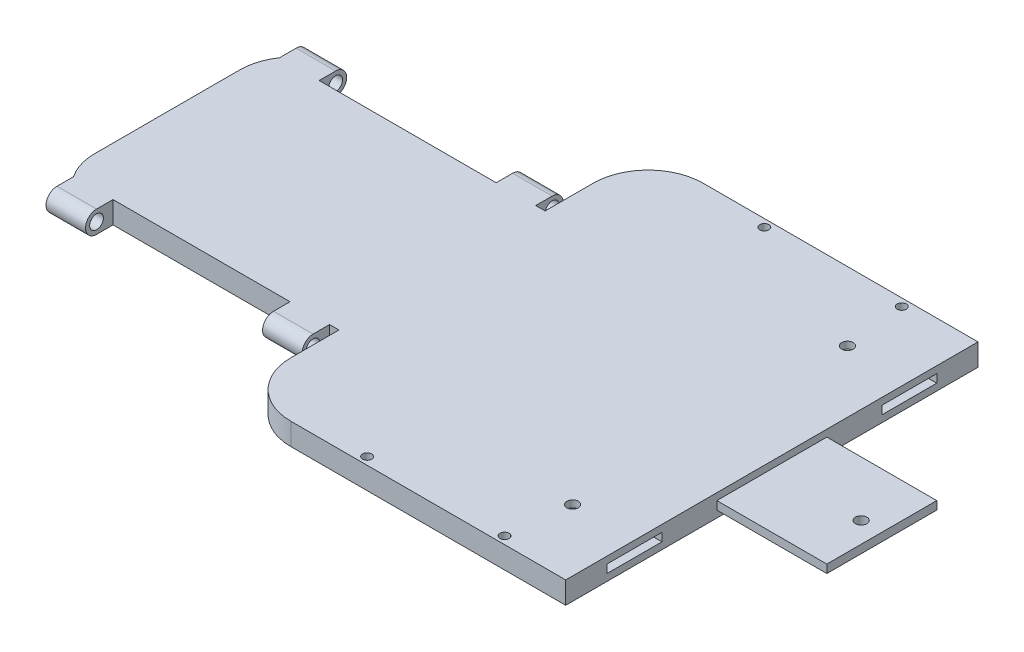
from build123d import *

# Parameters (mm, degrees)
BOSS_EXTRUDE1_DEPTH      = 8
BOSS_EXTRUDE2_DEPTH      = 46.583974855
BOSS_EXTRUDE2_DEPTH_BACK = 46.58397486
SKETCH4_R                = 3.3
CUT_EXTRUDE1_DEPTH       = 32.2
CUT_EXTRUDE1_DEPTH_BACK  = 32.2
SKETCH5_R                = 3.3
SKETCH6_W                = 40
SKETCH6_H                = 3
BOSS_EXTRUDE3_DEPTH      = 40
SKETCH7_R                = 2
CUT_EXTRUDE2_DEPTH       = 233.497849452
SKETCH8_W                = 20
SKETCH8_H                = 3
CUT_EXTRUDE3_DEPTH       = 30
SKETCH9_R                = 2
CUT_EXTRUDE4_DEPTH       = 233.570419443
FILLET1_R                = 20
SKETCH10_R               = 1.5
CUT_EXTRUDE5_DEPTH       = 10
SCALE1_SCALE             = 1.5
SCALE2_SCALE             = 0.8
SKETCH12_R               = 1.8
BOSS_EXTRUDE4_DEPTH      = 9.6
SKETCH13_R               = 2
SKETCH13_R_2             = 2.5
CUT_EXTRUDE6_DEPTH       = 262.790915701
BOSS_EXTRUDE5_REACH      = 322.905
SKETCH14_R               = 4.250728377
SKETCH14_R_2             = 3
SKETCH15_W               = 77.28
SKETCH15_H               = 12
CUT_EXTRUDE7_DEPTH       = 262.790915701
BOSS_EXTRUDE6_START      = -3.6
SKETCH16_R               = 2.5
BOSS_EXTRUDE6_DEPTH      = 3.6
SKETCH17_R               = 2.5
CUT_EXTRUDE8_DEPTH       = 262.698077073


with BuildPart() as part:
    # Sketch1 → Boss-Extrude1 (new body)
    with BuildSketch(Plane(origin=(0, 0, 0), x_dir=(1, 0, 0), z_dir=(0, 1, 0))):
        Polygon((-120, -37.5), (-120, -75), (0, -75), (0, 75), (-120, 75), (-120, 37.5), (-220, 37.5), (-220, -37.5), align=None)
    extrude(amount=BOSS_EXTRUDE1_DEPTH)

    # Sketch4 → Boss-Extrude2 (add, two sides: drawn at the far end of the back side and taken through both)
    # profile 1 of 2: a face of its own
    with BuildSketch(Plane.ZY.offset(170).offset(-BOSS_EXTRUDE2_DEPTH_BACK)):
        with BuildLine():
            Line((37.5, 8), (43.5, 8))
            ThreePointArc((43.5, 8), (47.5, 4), (43.5, 0))
            Line((43.5, 0), (37.5, 0))
            Line((37.5, 0), (37.5, 8))
        make_face()
        with Locations((43.5, 4)):
            Circle(SKETCH4_R, mode=Mode.SUBTRACT)
    # profile 2 of 2: a face of its own
    with BuildSketch(Plane.ZY.offset(170).offset(-BOSS_EXTRUDE2_DEPTH_BACK)):
        with BuildLine():
            Line((-37.5, 0), (-43.5, 0))
            ThreePointArc((-43.5, 0), (-47.5, 4), (-43.5, 8))
            Line((-43.5, 8), (-37.5, 8))
            Line((-37.5, 8), (-37.5, 0))
        make_face()
        with Locations((-43.5, 4)):
            Circle(SKETCH4_R, mode=Mode.SUBTRACT)
    extrude(amount=BOSS_EXTRUDE2_DEPTH + BOSS_EXTRUDE2_DEPTH_BACK)

    # Sketch5 → Cut-Extrude1 (cut, two sides: drawn at the far end of the back side and taken through both)
    # profile 1 of 2: a face of its own
    with BuildSketch(Plane.ZY.offset(170).offset(-CUT_EXTRUDE1_DEPTH_BACK)):
        with BuildLine():
            Line((-43.5, 8), (-37.5, 8))
            Line((-37.5, 8), (-37.5, 0))
            Line((-37.5, 0), (-43.5, 0))
            ThreePointArc((-43.5, 0), (-47.5, 4), (-43.5, 8))
        make_face()
        with Locations((-43.5, 4)):
            Circle(SKETCH5_R, mode=Mode.SUBTRACT)
    # profile 2 of 2: a face of its own
    with BuildSketch(Plane.ZY.offset(170).offset(-CUT_EXTRUDE1_DEPTH_BACK)):
        with BuildLine():
            Line((37.5, 0), (43.5, 0))
            ThreePointArc((43.5, 0), (47.5, 4), (43.5, 8))
            Line((43.5, 8), (37.5, 8))
            Line((37.5, 8), (37.5, 0))
        make_face()
        with Locations((43.5, 4)):
            Circle(SKETCH5_R, mode=Mode.SUBTRACT)
    extrude(amount=CUT_EXTRUDE1_DEPTH + CUT_EXTRUDE1_DEPTH_BACK, mode=Mode.SUBTRACT)

    # Sketch6 → Boss-Extrude3 (add)
    with BuildSketch(Plane(origin=(0, 0, 0), x_dir=(0, 0, -1), z_dir=(1, 0, 0))):
        with Locations((0, 4)):
            Rectangle(SKETCH6_W, SKETCH6_H)
    extrude(amount=BOSS_EXTRUDE3_DEPTH)

    # Sketch7 → Cut-Extrude2 (cut, through all)
    with BuildSketch(Plane(origin=(0, 5.5, 0), x_dir=(1, 0, 0), z_dir=(0, 1, 0))):
        with Locations(Location((32.75, 0, 0), (0, 0, 270))):
            Circle(SKETCH7_R)
    extrude(amount=-CUT_EXTRUDE2_DEPTH, mode=Mode.SUBTRACT)

    # Sketch8 → Cut-Extrude3 (cut)
    with BuildSketch(Plane(origin=(0, 0, 0), x_dir=(0, 0, -1), z_dir=(1, 0, 0))):
        with Locations((-50, 4)):
            Rectangle(SKETCH8_W, SKETCH8_H)
        with Locations((50, 4)):
            Rectangle(SKETCH8_W, SKETCH8_H)
    extrude(amount=-CUT_EXTRUDE3_DEPTH, mode=Mode.SUBTRACT)

    # Sketch9 → Cut-Extrude4 (cut, through all)
    with BuildSketch(Plane(origin=(0, 8, 0), x_dir=(1, 0, 0), z_dir=(0, 1, 0))):
        with Locations(Location((-22.5, -50, 0), (0, 0, 270))):
            Circle(SKETCH9_R)
        with Locations(Location((-22.5, 50, 0), (0, 0, 90))):
            Circle(SKETCH9_R)
    extrude(amount=-CUT_EXTRUDE4_DEPTH, mode=Mode.SUBTRACT)

    # Fillet1
    # the kernel refuses this fillet: 20 mm, written as the material it takes off along each edge
    with BuildSketch(Plane(origin=(-220, -27.947694226, 37.5), x_dir=(1, 0, 0), z_dir=(0, 1, 0))) as fillet1_piece_1:
        with BuildLine():
            CenterArc((20, 11.17907769), FILLET1_R, 180, 33.98348272)
            Line((0, 11.17907769), (-0.4, 11.17907769))
            Line((-0.4, 11.17907769), (-0.4, 0))
            Line((-0.4, 0), (0, -0.4))
            ThreePointArc((0, -0.4), (1.708012572, -0.4), (3.084345648, -0.223581554))
            Line((3.084345648, -0.223581554), (3.416025145, 0))
        make_face()
    extrude(amount=63.895388452, mode=Mode.SUBTRACT)
    with BuildSketch(Plane(origin=(-220, -27.947694226, -37.5), x_dir=(0, 0, 1), z_dir=(0, 1, 0))) as fillet1_piece_2:
        with BuildLine():
            CenterArc((11.17907769, 20), FILLET1_R, 236.01651728, 33.98348272)
            Line((0, 3.416025145), (-0.223581554, 3.084345648))
            ThreePointArc((-0.223581554, 3.084345648), (-0.4, 1.708012572), (-0.4, 0))
            Line((-0.4, 0), (0, -0.4))
            Line((0, -0.4), (11.17907769, -0.4))
            Line((11.17907769, -0.4), (11.17907769, 0))
        make_face()
    extrude(amount=63.895388452, mode=Mode.SUBTRACT)
    with BuildSketch(Plane(origin=(-120, -50, -75), x_dir=(1, 0, 0), z_dir=(0, 1, 0)), Plane(origin=(-120, -50, 75), x_dir=(0, 0, -1), z_dir=(0, 1, 0))) as fillet1_piece_3:
        with BuildLine():
            CenterArc((FILLET1_R, -FILLET1_R), FILLET1_R, 90, 90)
            Line((0, -FILLET1_R), (-FILLET1_R * 0.02, -FILLET1_R))
            Line((-FILLET1_R * 0.02, -FILLET1_R), (-FILLET1_R * 0.02, FILLET1_R * 0.02))
            Line((-FILLET1_R * 0.02, FILLET1_R * 0.02), (FILLET1_R, FILLET1_R * 0.02))
            Line((FILLET1_R, FILLET1_R * 0.02), (FILLET1_R, 0))
        make_face()
    extrude(amount=108, mode=Mode.SUBTRACT)

    # Sketch10 → Cut-Extrude5 (cut)
    with BuildSketch(Plane(origin=(0, 8, 0), x_dir=(1, 0, 0), z_dir=(0, 1, 0))):
        with Locations(Location((-25, 72.5, 0), (0, 0, 270))):
            Circle(SKETCH10_R)
        with Locations(Location((-75, 72.5, 0), (0, 0, 270))):
            Circle(SKETCH10_R)
        with Locations(Location((-25, -72.5, 0), (0, 0, 270))):
            Circle(SKETCH10_R)
        with Locations(Location((-75, -72.5, 0), (0, 0, 270))):
            Circle(SKETCH10_R)
    extrude(amount=-CUT_EXTRUDE5_DEPTH, mode=Mode.SUBTRACT)


with BuildPart() as part_1:
    # Scale1: scaled about (-91.766272815, 4, 0)
    add(part.part.scale(SCALE1_SCALE).moved(Location((45.883136407, -2, 0))))


with BuildPart() as part_2:
    # Scale2: scaled about (-91.766272815, 4, 0)
    add(part_1.part.scale(SCALE2_SCALE).moved(Location((-18.353254563, 0.8, 0))))

    # Sketch12 → Boss-Extrude4 (add, through all)
    with BuildSketch(Plane(origin=(0, 8.8, 0), x_dir=(1, 0, 0), z_dir=(0, 1, 0))):
        with Locations((-71.646745437, 87)):
            Circle(SKETCH12_R)
        with Locations((-11.646745437, 87)):
            Circle(SKETCH12_R)
        with Locations((-11.646745437, -87)):
            Circle(SKETCH12_R)
        with Locations((-71.646745437, -87)):
            Circle(SKETCH12_R)
    extrude(amount=-BOSS_EXTRUDE4_DEPTH)

    # Sketch13 → Cut-Extrude6 (cut, through all)
    with BuildSketch(Plane.XZ.offset(0.8)):
        with Locations(Location((-71.646745437, 86.7, 0), (0, 0, 270))):
            Circle(SKETCH13_R)
        with Locations(Location((-11.646745437, 86.7, 0), (0, 0, 90))):
            Circle(SKETCH13_R)
        with Locations(Location((-11.646745437, -86.7, 0), (0, 0, 270))):
            Circle(SKETCH13_R)
        with Locations(Location((-71.646745437, -86.7, 0), (0, 0, 90))):
            Circle(SKETCH13_R)
        with Locations(Location((-8.646745437, 60, 0), (0, 0, 270))):
            Circle(SKETCH13_R_2)
        with Locations(Location((57.653254563, 0, 0), (0, 0, 270))):
            Circle(SKETCH13_R_2)
        with Locations(Location((-8.646745437, -60, 0), (0, 0, 270))):
            Circle(SKETCH13_R_2)
    extrude(amount=-CUT_EXTRUDE6_DEPTH, mode=Mode.SUBTRACT)

    # Boss-Extrude5: up to this face of the body (flat: up to its plane)
    boss_extrude5_end = Plane(part_2.part.faces().sort_by_distance((-129.745975605, 8.646325018, -48.6))[0])
    # Sketch14 → Boss-Extrude5 (add, up to the picked face)
    with BuildSketch(Plane.ZY.offset(241.547515263), mode=Mode.PRIVATE) as boss_extrude5_sk1:
        with Locations((-52.2, 4)):
            Circle(SKETCH14_R)
        with Locations((-52.2, 4)):
            Circle(SKETCH14_R_2, mode=Mode.SUBTRACT)
    boss_extrude5_tool1 = split(extrude(boss_extrude5_sk1.sketch, amount=-BOSS_EXTRUDE5_REACH, mode=Mode.PRIVATE), bisect_by=boss_extrude5_end, keep=Keep.BOTH, mode=Mode.PRIVATE)
    # Sketch14 → Boss-Extrude5 (add, up to the picked face)
    with BuildSketch(Plane.ZY.offset(241.547515263), mode=Mode.PRIVATE) as boss_extrude5_sk2:
        with Locations(Location((52.2, 4, 0), (0, 0, 180))):
            Circle(SKETCH14_R)
        with Locations(Location((52.2, 4, 0), (0, 0, 180))):
            Circle(SKETCH14_R_2, mode=Mode.SUBTRACT)
    boss_extrude5_tool2 = split(extrude(boss_extrude5_sk2.sketch, amount=-BOSS_EXTRUDE5_REACH, mode=Mode.PRIVATE), bisect_by=boss_extrude5_end, keep=Keep.BOTH, mode=Mode.PRIVATE)
    add(boss_extrude5_tool1.solids().sort_by(Axis((-241.547515, 4, -56.3305), (1, 0, 0)))[0])
    add(boss_extrude5_tool2.solids().sort_by(Axis((-241.547515, 4, 56.3305), (1, 0, 0)))[0])

    # Sketch15 → Cut-Extrude7 (cut, through all)
    with BuildSketch(Plane(origin=(0, 8.8, 0), x_dir=(1, 0, 0), z_dir=(0, 1, 0))):
        with Locations((-185.646745437, 51)):
            Rectangle(SKETCH15_W, SKETCH15_H)
        with Locations((-185.646745437, -51)):
            Rectangle(SKETCH15_W, SKETCH15_H)
    extrude(amount=-CUT_EXTRUDE7_DEPTH, mode=Mode.SUBTRACT)

    # Sketch16 → Boss-Extrude6 (add)
    with BuildSketch(Plane(origin=(0, 5.8, 0), x_dir=(1, 0, 0), z_dir=(0, 1, 0)).offset(BOSS_EXTRUDE6_START)):
        with Locations((57.653254563, 0)):
            Circle(SKETCH16_R)
    extrude(amount=BOSS_EXTRUDE6_DEPTH)

    # Sketch17 → Cut-Extrude8 (cut, through all)
    with BuildSketch(Plane(origin=(0, 5.8, 0), x_dir=(1, 0, 0), z_dir=(0, 1, 0))):
        with Locations(Location((57.353254563, 0, 0), (0, 0, 270))):
            Circle(SKETCH17_R)
    extrude(amount=-CUT_EXTRUDE8_DEPTH, mode=Mode.SUBTRACT)


solid = part_2.part
